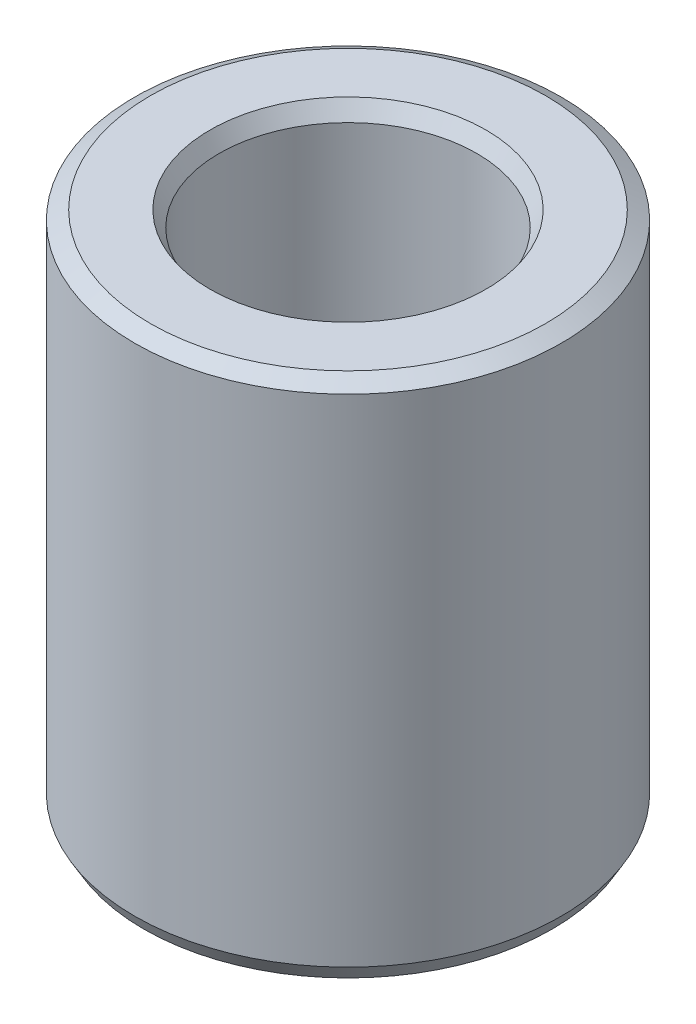
from build123d import *
from OCP.BRepFilletAPI import BRepFilletAPI_MakeChamfer

# Parameters (mm, degrees)
SKETCH1_R           = 47.5
BOSS_EXTRUDE1_DEPTH = 116.042489561
SKETCH2_R           = 28.703647152
CUT_EXTRUDE1_DEPTH  = 135.083404579
CHAMFER1_SIZE       = 2.027873159
CHAMFER1_SIZE2      = 3.512379343


with BuildPart() as part:
    # Sketch1 → Boss-Extrude1 (new body)
    with BuildSketch(Plane(origin=(0, 0, 0), x_dir=(1, 0, 0), z_dir=(0, 1, 0))):
        Circle(SKETCH1_R)
    extrude(amount=BOSS_EXTRUDE1_DEPTH)

    # Sketch2 → Cut-Extrude1 (cut, through all)
    with BuildSketch(Plane(origin=(0, 0, 0), x_dir=(1, 0, 0), z_dir=(0, 1, 0))):
        Circle(SKETCH2_R)
    extrude(amount=CUT_EXTRUDE1_DEPTH, mode=Mode.SUBTRACT)

    # Chamfer1: one chamfer whose edges measure the first distance from different faces: ONE call of the kernel's chamfer builder (chamfer() names one face for all edges)
    chamfer1_edges_1 = [part.edges().sort_by_distance(p)[0] for p in [
        (-28.703647152, 116.042489561, 0),
    ]]
    chamfer1_side_1 = [part.faces().sort_by_distance(p)[0] for p in [
        (-46.156497116, 116.042489561, 0),
    ]]
    chamfer1_edges_2 = [part.edges().sort_by_distance(p)[0] for p in [
        (-28.703647152, 0, 0),
    ]]
    chamfer1_side_2 = [part.faces().sort_by_distance(p)[0] for p in [
        (-28.703647152, 58.021244781, 0),
    ]]
    chamfer1_edges_3 = [part.edges().sort_by_distance(p)[0] for p in [
        (-47.5, 0, 0),
    ]]
    chamfer1_side_3 = [part.faces().sort_by_distance(p)[0] for p in [
        (-46.156497116, 0, 0),
    ]]
    chamfer1_edges_4 = [part.edges().sort_by_distance(p)[0] for p in [
        (-47.5, 116.042489561, 0),
    ]]
    chamfer1_side_4 = [part.faces().sort_by_distance(p)[0] for p in [
        (-47.5, 58.021244781, 0),
    ]]
    chamfer1 = BRepFilletAPI_MakeChamfer(part.part.solid().wrapped)
    for e in chamfer1_edges_1:
        chamfer1.Add(CHAMFER1_SIZE, CHAMFER1_SIZE2, e.wrapped, chamfer1_side_1[0].wrapped)  # the first distance lies on this face
    for e in chamfer1_edges_2:
        chamfer1.Add(CHAMFER1_SIZE, CHAMFER1_SIZE2, e.wrapped, chamfer1_side_2[0].wrapped)  # the first distance lies on this face
    for e in chamfer1_edges_3:
        chamfer1.Add(CHAMFER1_SIZE, CHAMFER1_SIZE2, e.wrapped, chamfer1_side_3[0].wrapped)  # the first distance lies on this face
    for e in chamfer1_edges_4:
        chamfer1.Add(CHAMFER1_SIZE, CHAMFER1_SIZE2, e.wrapped, chamfer1_side_4[0].wrapped)  # the first distance lies on this face
    add(Compound.cast(chamfer1.Shape()), mode=Mode.REPLACE)


solid = part.part
